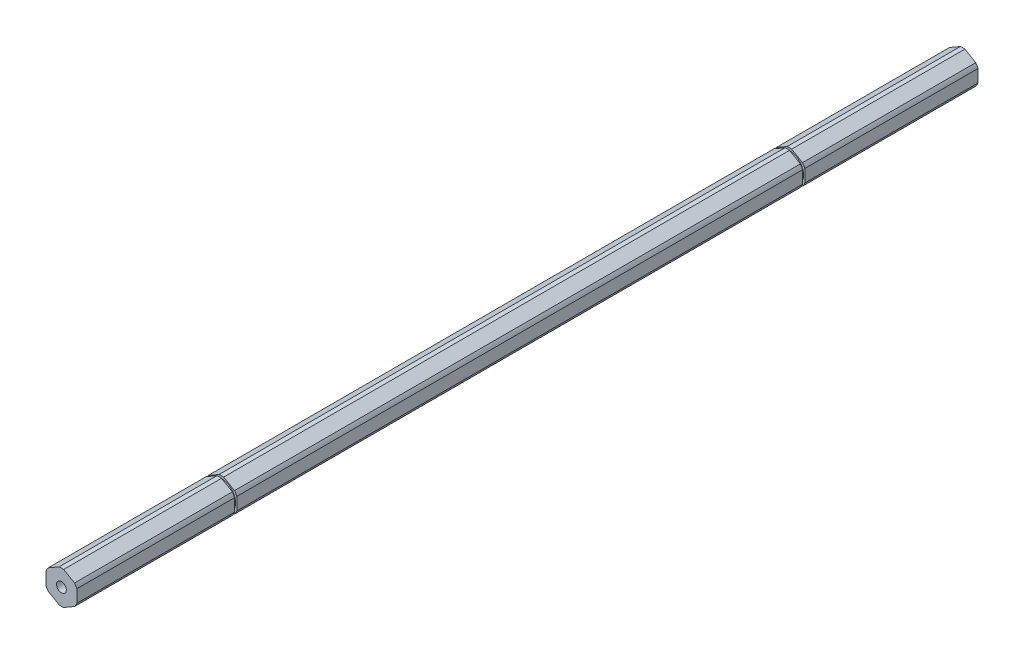
from build123d import *

# Parameters (mm, degrees)
BOSS_EXTRUDE1_DEPTH = 185.801
SKETCH2_R           = 2.0193
CUT_EXTRUDE1_DEPTH  = 372.719519353
SKETCH4_W           = 3.175
SKETCH4_H           = 0.889


with BuildPart() as part:
    # Sketch1 → Boss-Extrude1 (new, symmetric)
    with BuildSketch(Plane.XY):
        with BuildLine():
            ThreePointArc((0.93173274, 6.79441227), (0, 6.858), (-0.93173274, 6.79441227))
            Line((-0.93173274, 6.79441227), (-5.41826726, 4.204110358))
            ThreePointArc((-5.41826726, 4.204110358), (-5.939202219, 3.429), (-6.35, 2.590301913))
            Line((-6.35, 2.590301913), (-6.35, -2.590301913))
            ThreePointArc((-6.35, -2.590301913), (-5.939202219, -3.429), (-5.41826726, -4.204110358))
            Line((-5.41826726, -4.204110358), (-0.93173274, -6.79441227))
            ThreePointArc((-0.93173274, -6.79441227), (0, -6.858), (0.93173274, -6.79441227))
            Line((0.93173274, -6.79441227), (5.41826726, -4.204110358))
            ThreePointArc((5.41826726, -4.204110358), (5.939202219, -3.429), (6.35, -2.590301913))
            Line((6.35, -2.590301913), (6.35, 2.590301913))
            ThreePointArc((6.35, 2.590301913), (5.939202219, 3.429), (5.41826726, 4.204110358))
            Line((5.41826726, 4.204110358), (0.93173274, 6.79441227))
        make_face()
    extrude(amount=BOSS_EXTRUDE1_DEPTH, both=True)

    # Sketch2 → Cut-Extrude1 (cut, through all)
    with BuildSketch(Plane.XY.offset(185.801)):
        Circle(SKETCH2_R)
    extrude(amount=-CUT_EXTRUDE1_DEPTH, mode=Mode.SUBTRACT)

    # Sketch4 → Cut-Revolve4 (revolve, cut)
    with BuildSketch(Plane(origin=(0, 0, 0), x_dir=(1, 0, 0), z_dir=(0, 1, 0))):
        with Locations((7.4422, 113.9317)):
            Rectangle(SKETCH4_W, SKETCH4_H)
        with Locations((7.4422, -120.2817)):
            Rectangle(SKETCH4_W, SKETCH4_H)
    revolve(axis=Axis((0, 0, -185.801), (0, 0, 1)), mode=Mode.SUBTRACT)


solid = part.part
